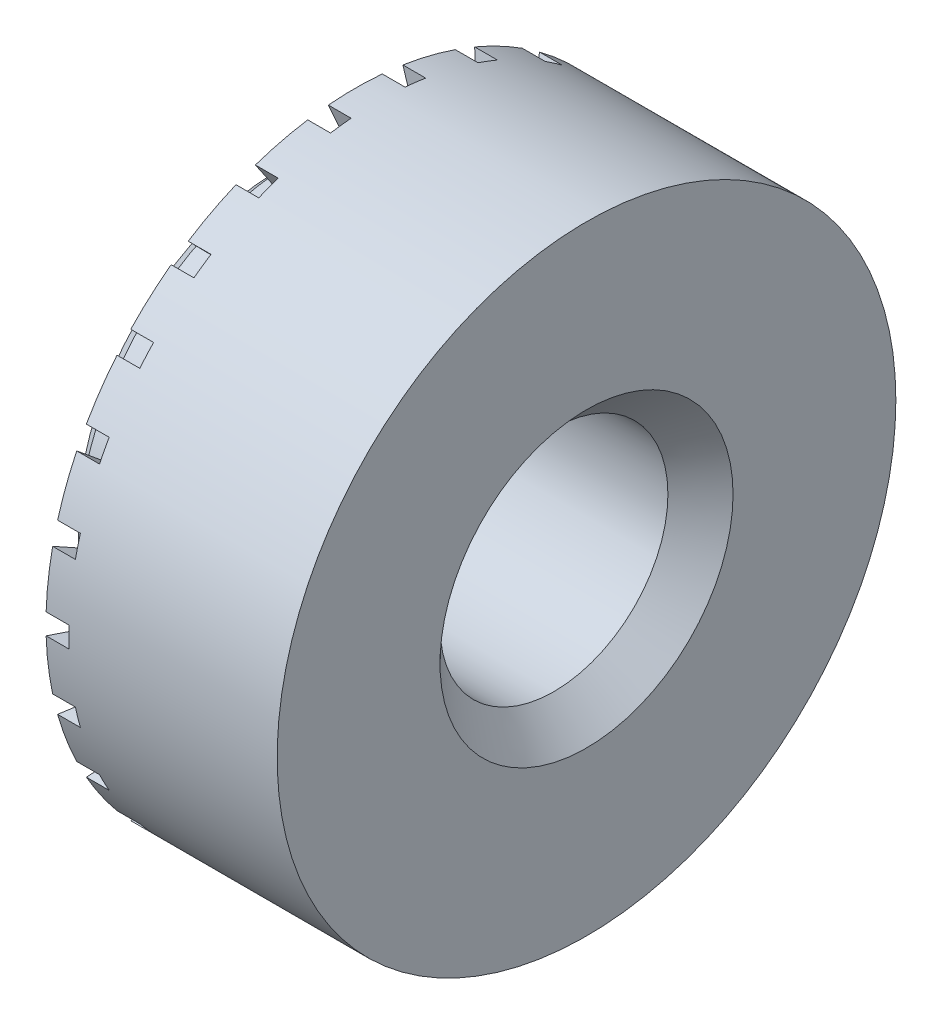
from build123d import *

# Parameters (mm, degrees)
SKETCH_1_R               = 4.75
EXTRUDE_1_DEPTH          = 3.2
SKETCH_2_R               = 3.35
EXTRUDE_2_DEPTH          = 1.5
SKETCH_3_R               = 1.75
CUT_EXTRUDE_1_DEPTH      = 9.198475468
CHAMFER_1_SIZE           = 0.5
CHAMFER_2_SIZE           = 0.25
REVOLVE_1_ANGLE          = 10
CUT_EXTRUDE_3_DEPTH      = 8.44076609
PATTERN_CIRCULAR_1_COUNT = 26


# Read off the part's stored shape, not the designer's step: Повернуть1
with BuildPart() as part:
    # Эскиз1 → Вытянуть1 (new body)
    with BuildSketch(Plane(origin=(0, 0, 0), x_dir=(0, 0, -1), z_dir=(1, 0, 0))):
        Circle(SKETCH_1_R)
    extrude(amount=EXTRUDE_1_DEPTH)

    # Эскиз2 → Вытянуть2 (add)
    with BuildSketch(Plane.ZY):
        with Locations(Location((0, 0, 0), (0, 0, 180))):
            Circle(SKETCH_2_R)
    extrude(amount=EXTRUDE_2_DEPTH)

    # Эскиз3 → Вырез-Вытянуть1 (cut, through all)
    with BuildSketch(Plane(origin=(3.2, 0, 0), x_dir=(0, 0, -1), z_dir=(1, 0, 0))):
        Circle(SKETCH_3_R)
    extrude(amount=-CUT_EXTRUDE_1_DEPTH, mode=Mode.SUBTRACT)

    # Фаска1
    chamfer_1_edges = [part.edges().sort_by_distance(p)[0] for p in [
        (-1.5, 0, 1.75),
        (3.2, 0, 1.75),
    ]]
    chamfer(chamfer_1_edges, length=CHAMFER_1_SIZE)

    # Фаска2
    chamfer_2_edges = [part.edges().sort_by_distance(p)[0] for p in [
        (-1.5, 0, 3.35),
    ]]
    chamfer(chamfer_2_edges, length=CHAMFER_2_SIZE)

    # Повернуть1 outline → Повернуть1 (revolve)
    with BuildSketch(Plane(origin=(0, 0, 0), x_dir=(0, 0.9961946980917455, -0.08715574274765835), z_dir=(0, -0.08715574274765835, -0.9961946980917455))):
        Polygon((4.75, 0), (3.35, 0), (4.75, -0.35), align=None)
    revolve(axis=Axis((0, 0, 0), (1, 0, 0)), revolution_arc=REVOLVE_1_ANGLE)

    # Эскиз5 → Вырез-Вытянуть3 (cut, through all)
    with BuildSketch(Plane.ZY):
        with BuildLine():
            Line((-0.291971738, 3.337252239), (-0.413989778, 4.731924816))
            ThreePointArc((-0.413989778, 4.731924816), (-0.416697281, 4.73168716), (-0.419404647, 4.731447954))
            Line((-0.419404647, 4.731447954), (-0.419404647, 3.323642541))
            ThreePointArc((-0.419404647, 3.323642541), (-0.35575328, 3.33105683), (-0.291971738, 3.337252239))
        make_face()
        with BuildLine():
            ThreePointArc((-0.291971738, 3.337252239), (-0.146124948, 3.346811542), (0, 3.35))
            Line((0, 3.35), (-0.413989778, 4.731924816))
            Line((-0.413989778, 4.731924816), (-0.291971738, 3.337252239))
        make_face()
        with BuildLine():
            Line((0.413989778, 4.731924816), (0, 3.35))
            ThreePointArc((0, 3.35), (0.146124948, 3.346811542), (0.291971738, 3.337252239))
            Line((0.291971738, 3.337252239), (0.413989778, 4.731924816))
        make_face()
        with BuildLine():
            ThreePointArc((0.419404647, 4.731447954), (0.416697281, 4.73168716), (0.413989778, 4.731924816))
            Line((0.413989778, 4.731924816), (0.291971738, 3.337252239))
            ThreePointArc((0.291971738, 3.337252239), (0.35575328, 3.33105683), (0.419404647, 3.323642541))
            Line((0.419404647, 3.323642541), (0.419404647, 4.731447954))
        make_face()
    extrude(amount=CUT_EXTRUDE_3_DEPTH, mode=Mode.SUBTRACT)

    # Круговой массив1: part ×26 about axis
    pattern_circular_1_axis = Axis((0, 0, 0), (1, 0, 0))


with BuildPart() as part_1:
    add(part.part)
    for i in range(1, PATTERN_CIRCULAR_1_COUNT):
        add(part.part.rotate(pattern_circular_1_axis, i * 360 / PATTERN_CIRCULAR_1_COUNT))


solid = part_1.part
